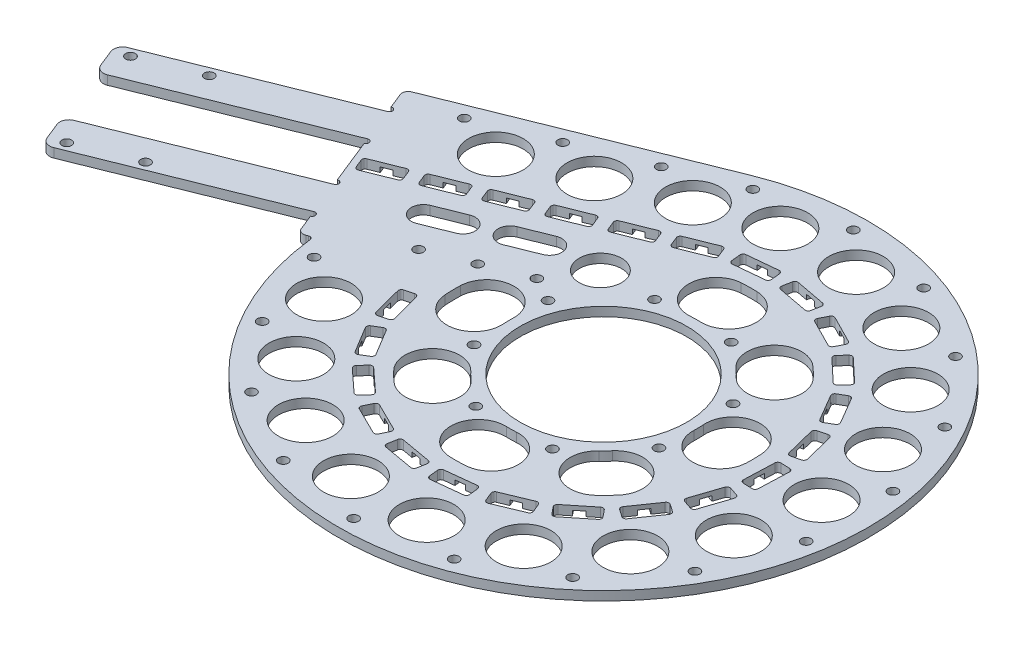
from build123d import *

# Parameters (mm, degrees)
SKETCH_1_R                       = 87.5
SKETCH_1_R_2                     = 27.5
EXTRUDE_1_DEPTH                  = 3
SKETCH_2_R                       = 1.6
CUT_EXTRUDE_1_DEPTH              = 3
PATTERN_CIRCULAR_1_COUNT         = 8
CUT_EXTRUDE_2_DEPTH              = 3
FILLET_1_R                       = 1
CUT_EXTRUDE_3_DEPTH              = 1.6
PATTERN_CIRCULAR_2_COUNT         = 18
PATTERN_CIRCULAR_2_ANGLE         = 277.1
FILLET_1_OF_PATTERN_CIRCULAR_2_R = 1
CUT_EXTRUDE_5_DEPTH              = 3
PATTERN_CIRCULAR_4_COUNT         = 7
PATTERN_CIRCULAR_4_ANGLE         = 270
EXTRUDE_2_DEPTH                  = 3
PATTERN_LINEAR_3_COUNT           = 6
PATTERN_LINEAR_3_PITCH           = 16
FILLET_1_OF_PATTERN_LINEAR_3_R   = 1
SKETCH_16_R                      = 1.6
CUT_EXTRUDE_6_DEPTH              = 10
PATTERN_LINEAR_4_COUNT           = 3
PATTERN_LINEAR_4_PITCH           = 15
SKETCH_18_R                      = 1.6
CUT_EXTRUDE_7_DEPTH              = 6.5
PATTERN_START                    = -1
PATTERN_CIRCULAR_5_OUTLINE_R     = 1.6
PATTERN_CIRCULAR_5_DEPTH         = 5
SKETCH_21_R                      = 9
CUT_EXTRUDE_8_DEPTH              = 6.5
PATTERN_CIRCULAR_6_OUTLINE_R     = 9
PATTERN_CIRCULAR_6_DEPTH         = 3
SKETCH_23_R                      = 1.6
SKETCH_23_R_2                    = 9
CUT_EXTRUDE_9_DEPTH              = 18
PATTERN_LINEAR_5_COUNT           = 3
PATTERN_LINEAR_5_PITCH           = 25
FILLET_2_R                       = 1
FILLET_3_R                       = 2
SKETCH_27_R                      = 1.6
EXTRUDE_3_DEPTH                  = 3
SKETCH_28_R                      = 1
CUT_EXTRUDE_10_DEPTH             = 3
FILLET_4_R                       = 3
SKETCH_30_R                      = 7
CUT_EXTRUDE_11_DEPTH             = 3


with BuildPart() as part:
    # 草图1 → 凸台-拉伸1 (new body)
    with BuildSketch(Plane(origin=(0, 0, 0), x_dir=(1, 0, 0), z_dir=(0, 1, 0))):
        with Locations(Location((0, 0, 0), (0, 0, 270))):
            Circle(SKETCH_1_R)
        with Locations(Location((0, 0, 0), (0, 0, 270))):
            Circle(SKETCH_1_R_2, mode=Mode.SUBTRACT)
    extrude(amount=EXTRUDE_1_DEPTH)

    # 草图2 → 切除-拉伸1 (cut)
    with BuildSketch(Plane(origin=(0, 3, 0), x_dir=(1, 0, 0), z_dir=(0, 1, 0))):
        with Locations(Location((-12.953736655, 29.806890255, 0), (0, 0, 270))):
            Circle(SKETCH_2_R)
    cut_extrude_1 = extrude(amount=-CUT_EXTRUDE_1_DEPTH, mode=Mode.SUBTRACT)

    # 阵列(圆周)1: 切除-拉伸1 ×8 about axis
    pattern_circular_1_axis = Axis((0, 0, 0), (0, 1, 0))
    for i in range(1, PATTERN_CIRCULAR_1_COUNT):
        add(cut_extrude_1.rotate(pattern_circular_1_axis, i * 360 / PATTERN_CIRCULAR_1_COUNT), mode=Mode.SUBTRACT)

    # 草图4 → 切除-拉伸2 (cut)
    with BuildSketch(Plane(origin=(0, 3, 0), x_dir=(1, 0, 0), z_dir=(0, 1, 0))):
        Polygon((-26.472850278, 49.711047043), (-27.406183612, 52.030290215), (-16.273816388, 56.510290215), (-14.407149722, 51.871803872), (-25.539516945, 47.391803872), align=None)
    cut_extrude_2 = extrude(amount=-CUT_EXTRUDE_2_DEPTH, mode=Mode.SUBTRACT)

    # 圆角1
    fillet_1_edges = [part.edges().sort_by_distance(p)[0] for p in [
        (-25.539516945, 1.5, -47.391803872),
        (-27.406183612, 1.5, -52.030290215),
        (-16.273816388, 1.5, -56.510290215),
        (-14.407149722, 1.5, -51.871803872),
    ]]
    fillet(fillet_1_edges, radius=FILLET_1_R)

    # 草图6 → 切除-拉伸3 (cut)
    with BuildSketch(Plane.XZ):
        with BuildLine():
            Line((-24.257648963, -55.992200053), (-20.52431563, -46.715227367))
            ThreePointArc((-20.52431563, -46.715227367), (-18.442666667, -45.82824507), (-17.55568437, -47.909894033))
            Line((-17.55568437, -47.909894033), (-21.289017704, -57.18686672))
            ThreePointArc((-21.289017704, -57.18686672), (-23.370666667, -58.073849016), (-24.257648963, -55.992200053))
        make_face()
    cut_extrude_3 = extrude(amount=-CUT_EXTRUDE_3_DEPTH, mode=Mode.SUBTRACT)

    # 阵列(圆周)2: 切除-拉伸2, 切除-拉伸3 ×18 about axis
    pattern_circular_2_axis = Axis((0, 0, 0), (0, -1, 0))
    add([cut_extrude_2.rotate(pattern_circular_2_axis, i * PATTERN_CIRCULAR_2_ANGLE / (PATTERN_CIRCULAR_2_COUNT - 1)) for i in range(1, PATTERN_CIRCULAR_2_COUNT)], mode=Mode.SUBTRACT)
    add([cut_extrude_3.rotate(pattern_circular_2_axis, i * PATTERN_CIRCULAR_2_ANGLE / (PATTERN_CIRCULAR_2_COUNT - 1)) for i in range(1, PATTERN_CIRCULAR_2_COUNT)], mode=Mode.SUBTRACT)

    # 圆角1 of 阵列(圆周)2
    fillet_1_of_pattern_circular_2_edges = [part.edges().sort_by_distance(p)[0] for p in [
        (-11.211661896, 1.5, -52.654996321),
        (-11.701429745, 1.5, -57.63095125),
        (0.240862085, 1.5, -58.806394086),
        (0.730629933, 1.5, -53.830439158),
        (4.017492106, 1.5, -53.685284363),
        (4.943995227, 1.5, -58.598693767),
        (16.736177795, 1.5, -56.375086278),
        (15.809674675, 1.5, -51.461676874),
        (18.923682264, 1.5, -50.399843746),
        (21.191975309, 1.5, -54.855721511),
        (31.886081946, 1.5, -49.411818203),
        (29.617788901, 1.5, -44.955940437),
        (32.308608654, 1.5, -43.06278912),
        (35.736344871, 1.5, -46.702929836),
        (44.472682589, 1.5, -38.476362917),
        (41.044946373, 1.5, -34.836222201),
        (43.096264862, 1.5, -32.263942024),
        (47.407890537, 1.5, -34.795716904),
        (53.484150248, 1.5, -24.447815285),
        (49.172524574, 1.5, -21.916040405),
        (50.419437504, 1.5, -18.871415469),
        (55.268343567, 1.5, -20.091296609),
        (58.196058302, 1.5, -8.453922058),
        (53.347152239, 1.5, -7.234040918),
        (53.689421007, 1.5, -3.961826844),
        (58.685806731, 1.5, -3.771748711),
        (58.229619211, 1.5, 8.219577027),
        (53.233233487, 1.5, 8.029498893),
        (52.643343307, 1.5, 11.266250727),
        (57.385552162, 1.5, 12.851007863),
        (53.582135036, 1.5, 24.232309114),
        (48.839926181, 1.5, 22.647551978),
        (47.36529798, 1.5, 25.588640981),
        (51.472106565, 1.5, 28.440679419),
        (44.627214314, 1.5, 38.297020022),
        (40.52040573, 1.5, 35.444981584),
        (38.279584007, 1.5, 37.853975329),
        (41.420848378, 1.5, 41.744021364),
        (32.084737894, 1.5, 49.283055854),
        (28.943473524, 1.5, 45.393009819),
        (26.11659663, 1.5, 47.076250705),
        (28.039792378, 1.5, 51.691585809),
        (16.962988131, 1.5, 56.307255604),
        (15.039792382, 1.5, 51.691920501),
        (11.8541113, 1.5, 52.514093778),
        (12.404633843, 1.5, 57.483693855),
        (0.477593657, 1.5, 58.804947958),
        (-0.072928886, 1.5, 53.83534788),
        (-3.361319115, 1.5, 53.730359517),
        (-4.227725964, 1.5, 58.65472132),
        (-16.046194293, 1.5, 56.575344884),
        (-15.179787444, 1.5, 51.65098308),
        (-18.30653505, 1.5, 50.62727303),
        (-20.520221349, 1.5, 55.11052999),
        (-31.280038053, 1.5, 49.797682872),
        (-29.066351753, 1.5, 45.314425912),
        (-31.780099321, 1.5, 43.454289629),
        (-35.163108122, 1.5, 47.136035336),
        (-43.99929782, 1.5, 39.016814214),
        (-40.616289019, 1.5, 35.335068506),
        (-42.698879967, 1.5, 32.788041259),
        (-46.979253167, 1.5, 35.372302326),
        (-53.181479728, 1.5, 25.099406644),
        (-48.901106528, 1.5, 22.515145577),
        (-50.185122586, 1.5, 19.485981399),
        (-55.018763484, 1.5, 20.765010588),
        (-58.088433537, 1.5, 9.164272432),
        (-53.254792639, 1.5, 7.885243243),
    ]]
    fillet(fillet_1_of_pattern_circular_2_edges, radius=FILLET_1_OF_PATTERN_CIRCULAR_2_R)

    # 草图10 → 切除-拉伸5 (cut)
    with BuildSketch(Plane(origin=(0, 3, 0), x_dir=(1, 0, 0), z_dir=(0, 1, 0))):
        with BuildLine():
            ThreePointArc((1.719289285, 48.969827898), (-0.845949711, 48.9926971), (-3.408870018, 48.881280724))
            ThreePointArc((-3.408870018, 48.881280724), (-11.760945454, 39.276967322), (-2.156632052, 30.924891887))
            ThreePointArc((-2.156632052, 30.924891887), (-0.535192674, 30.995379798), (1.08771363, 30.980911527))
            ThreePointArc((1.08771363, 30.980911527), (10.397959643, 39.659581885), (1.719289285, 48.969827898))
        make_face()
    cut_extrude_5 = extrude(amount=-CUT_EXTRUDE_5_DEPTH, mode=Mode.SUBTRACT)

    # 阵列(圆周)4: 切除-拉伸5 ×7 about axis
    pattern_circular_4_axis = Axis((0, 0, 0), (0, -1, 0))
    for i in range(1, PATTERN_CIRCULAR_4_COUNT):
        add(cut_extrude_5.rotate(pattern_circular_4_axis, i * PATTERN_CIRCULAR_4_ANGLE / (PATTERN_CIRCULAR_4_COUNT - 1)), mode=Mode.SUBTRACT)

    # 草图12 → 凸台-拉伸2 (add)
    with BuildSketch(Plane(origin=(0, 3, 0), x_dir=(1, 0, 0), z_dir=(0, 1, 0))):
        Polygon((-90.784026306, -10.124750252), (-114.304026306, 48.320177672), (-32.666666667, 81.173511005), (-87.073237232, -8.631416919), align=None)
    extrude(amount=-EXTRUDE_2_DEPTH)

    # 阵列(线性)3: 切除-拉伸2, 切除-拉伸3 ×6
    with Locations(*[Vector(-0.9276972686292778, 0, 0.37333333333333313) * (i * PATTERN_LINEAR_3_PITCH) for i in range(1, PATTERN_LINEAR_3_COUNT)]):
        add(cut_extrude_2, mode=Mode.SUBTRACT)
        add(cut_extrude_3, mode=Mode.SUBTRACT)

    # 圆角1 of 阵列(线性)3
    fillet_1_of_pattern_linear_3_edges = [part.edges().sort_by_distance(p)[0] for p in [
        (-40.382673243, 1.5, -41.418470538),
        (-42.24933991, 1.5, -46.056956881),
        (-31.116972686, 1.5, -50.536956881),
        (-29.25030602, 1.5, -45.898470538),
        (-55.225829541, 1.5, -35.445137205),
        (-57.092496208, 1.5, -40.083623548),
        (-45.960128984, 1.5, -44.563623548),
        (-44.093462318, 1.5, -39.925137205),
        (-70.068985839, 1.5, -29.471803872),
        (-71.935652506, 1.5, -34.110290215),
        (-60.803285282, 1.5, -38.590290215),
        (-58.936618616, 1.5, -33.951803872),
        (-84.912142137, 1.5, -23.498470538),
        (-86.778808804, 1.5, -28.136956881),
        (-75.64644158, 1.5, -32.616956881),
        (-73.779774914, 1.5, -27.978470538),
        (-99.755298435, 1.5, -17.525137205),
        (-101.621965102, 1.5, -22.163623548),
        (-90.489597879, 1.5, -26.643623548),
        (-88.622931212, 1.5, -22.005137205),
    ]]
    fillet(fillet_1_of_pattern_linear_3_edges, radius=FILLET_1_OF_PATTERN_LINEAR_3_R)

    # 草图16 → 切除-拉伸6 (cut)
    with BuildSketch(Plane(origin=(0, 3, 0), x_dir=(1, 0, 0), z_dir=(0, 1, 0))):
        with Locations(Location((-66.211320817, 5.153736091, 0), (0, 0, 270))):
            Circle(SKETCH_16_R)
    cut_extrude_6 = extrude(amount=-CUT_EXTRUDE_6_DEPTH, mode=Mode.SUBTRACT)

    # 阵列(线性)4: 切除-拉伸6 ×3
    with Locations(*[Vector(0.9276972686292778, 0, -0.37333333333333324) * (i * PATTERN_LINEAR_4_PITCH) for i in range(1, PATTERN_LINEAR_4_COUNT)]):
        add(cut_extrude_6, mode=Mode.SUBTRACT)

    # 草图18 → 切除-拉伸7 (cut)
    with BuildSketch(Plane(origin=(0, 3, 0), x_dir=(1, 0, 0), z_dir=(0, 1, 0))):
        with Locations(Location((0, 82.5, 0), (0, 0, 270))):
            Circle(SKETCH_18_R)
    extrude(amount=-CUT_EXTRUDE_7_DEPTH, mode=Mode.SUBTRACT)

    # 阵列(圆周)5: read off the stored shape, not the designer's step
    # 阵列(圆周)5 outline → 阵列(圆周)5 (cut)
    with BuildSketch(Plane(origin=(0, 0, 0), x_dir=(1, 0, 0), z_dir=(0, 1, 0)).offset(PATTERN_START)):
        with Locations((28.216661824, 77.524641215)):
            Circle(PATTERN_CIRCULAR_5_OUTLINE_R)
        with Locations((53.029977799, 63.198666557)):
            Circle(PATTERN_CIRCULAR_5_OUTLINE_R)
        with Locations((71.447095812, 41.25)):
            Circle(PATTERN_CIRCULAR_5_OUTLINE_R)
        with Locations((81.246639624, 14.325974658)):
            Circle(PATTERN_CIRCULAR_5_OUTLINE_R)
        with Locations((81.246639624, -14.325974658)):
            Circle(PATTERN_CIRCULAR_5_OUTLINE_R)
        with Locations((71.447095812, -41.25)):
            Circle(PATTERN_CIRCULAR_5_OUTLINE_R)
        with Locations((53.029977799, -63.198666557)):
            Circle(PATTERN_CIRCULAR_5_OUTLINE_R)
        with Locations((28.216661824, -77.524641215)):
            Circle(PATTERN_CIRCULAR_5_OUTLINE_R)
        with Locations((0, -82.5)):
            Circle(PATTERN_CIRCULAR_5_OUTLINE_R)
        with Locations((-28.216661824, -77.524641215)):
            Circle(PATTERN_CIRCULAR_5_OUTLINE_R)
        with Locations((-53.029977799, -63.198666557)):
            Circle(PATTERN_CIRCULAR_5_OUTLINE_R)
        with Locations((-71.447095812, -41.25)):
            Circle(PATTERN_CIRCULAR_5_OUTLINE_R)
        with Locations((-81.246639624, -14.325974658)):
            Circle(PATTERN_CIRCULAR_5_OUTLINE_R)
        with Locations((-28.216661824, 77.524641215)):
            Circle(PATTERN_CIRCULAR_5_OUTLINE_R)
    extrude(amount=PATTERN_CIRCULAR_5_DEPTH, mode=Mode.SUBTRACT)

    # 草图21 → 切除-拉伸8 (cut)
    with BuildSketch(Plane(origin=(0, 3, 0), x_dir=(1, 0, 0), z_dir=(0, 1, 0))):
        with Locations(Location((12.502668792, 70.906158217, 0), (0, 0, 270))):
            Circle(SKETCH_21_R)
    extrude(amount=-CUT_EXTRUDE_8_DEPTH, mode=Mode.SUBTRACT)

    # 阵列(圆周)6: read off the stored shape, not the designer's step
    # 阵列(圆周)6 outline → 阵列(圆周)6 (cut)
    with BuildSketch(Plane(origin=(0, 0, 0), x_dir=(1, 0, 0), z_dir=(0, 1, 0))):
        with Locations((36, 62.353829072)):
            Circle(PATTERN_CIRCULAR_6_OUTLINE_R)
        with Locations((-12.502668792, 70.906158217)):
            Circle(PATTERN_CIRCULAR_6_OUTLINE_R)
        with Locations((-67.657868697, -24.625450319)):
            Circle(PATTERN_CIRCULAR_6_OUTLINE_R)
        with Locations((-55.155199905, -46.280707897)):
            Circle(PATTERN_CIRCULAR_6_OUTLINE_R)
        with Locations((-36, -62.353829072)):
            Circle(PATTERN_CIRCULAR_6_OUTLINE_R)
        with Locations((-12.502668792, -70.906158217)):
            Circle(PATTERN_CIRCULAR_6_OUTLINE_R)
        with Locations((12.502668792, -70.906158217)):
            Circle(PATTERN_CIRCULAR_6_OUTLINE_R)
        with Locations((36, -62.353829072)):
            Circle(PATTERN_CIRCULAR_6_OUTLINE_R)
        with Locations((55.155199905, -46.280707897)):
            Circle(PATTERN_CIRCULAR_6_OUTLINE_R)
        with Locations((67.657868697, -24.625450319)):
            Circle(PATTERN_CIRCULAR_6_OUTLINE_R)
        with Locations((72, 0)):
            Circle(PATTERN_CIRCULAR_6_OUTLINE_R)
        with Locations((67.657868697, 24.625450319)):
            Circle(PATTERN_CIRCULAR_6_OUTLINE_R)
        with Locations((55.155199905, 46.280707897)):
            Circle(PATTERN_CIRCULAR_6_OUTLINE_R)
    extrude(amount=PATTERN_CIRCULAR_6_DEPTH, mode=Mode.SUBTRACT)

    # 草图23 → 切除-拉伸9 (cut)
    with BuildSketch(Plane(origin=(0, 3, 0), x_dir=(1, 0, 0), z_dir=(0, 1, 0))):
        with Locations(Location((-49.817794007, 68.881691329, 0), (0, 0, 270))):
            Circle(SKETCH_23_R)
        with Locations(Location((-34.301578149, 63.807536675, 0), (0, 0, 270))):
            Circle(SKETCH_23_R_2)
    cut_extrude_9 = extrude(amount=-CUT_EXTRUDE_9_DEPTH, mode=Mode.SUBTRACT)

    # 阵列(线性)5: 切除-拉伸9 ×3
    with Locations(*[Vector(-0.9276972686292778, 0, 0.37333333333333324) * (i * PATTERN_LINEAR_5_PITCH) for i in range(1, PATTERN_LINEAR_5_COUNT)]):
        add(cut_extrude_9, mode=Mode.SUBTRACT)

    # 圆角2
    fillet_2_edges = [part.edges().sort_by_distance(p)[0] for p in [
        (-87.073237232, 1.5, 8.631416919),
    ]]
    fillet(fillet_2_edges, radius=FILLET_2_R)

    # 圆角3
    fillet_3_edges = [part.edges().sort_by_distance(p)[0] for p in [
        (-90.784026306, 1.5, 10.124750252),
        (-114.304026306, 1.5, -48.320177672),
    ]]
    fillet(fillet_3_edges, radius=FILLET_3_R)

    # 草图27 → 凸台-拉伸3 (add)
    # profile 1 of 2: a face of its own
    with BuildSketch(Plane(origin=(0, 3, 0), x_dir=(1, 0, 0), z_dir=(0, 1, 0))):
        Polygon((-110.757359639, 39.50705362), (-174.768471175, 13.74705362), (-170.288471175, 2.614686396), (-106.277359639, 28.374686396), align=None)
        with Locations(Location((-169.009984832, 12.830628481, 0), (0, 0, 270))):
            Circle(SKETCH_27_R, mode=Mode.SUBTRACT)
        with Locations(Location((-150.456039459, 20.297295147, 0), (0, 0, 270))):
            Circle(SKETCH_27_R, mode=Mode.SUBTRACT)
    # profile 2 of 2: a face of its own
    with BuildSketch(Plane(origin=(0, 3, 0), x_dir=(1, 0, 0), z_dir=(0, 1, 0))):
        Polygon((-98.810692973, 9.820741024), (-94.330692973, -1.3116262), (-158.341804508, -27.0716262), (-162.821804508, -15.939258976), align=None)
        with Locations(Location((-136.269372792, -14.955201061, 0), (0, 0, 90))):
            Circle(SKETCH_27_R, mode=Mode.SUBTRACT)
        with Locations(Location((-154.823318165, -22.421867727, 0), (0, 0, 90))):
            Circle(SKETCH_27_R, mode=Mode.SUBTRACT)
    extrude(amount=-EXTRUDE_3_DEPTH)

    # 草图28 → 切除-拉伸10 (cut)
    with BuildSketch(Plane(origin=(0, 3, 0), x_dir=(1, 0, 0), z_dir=(0, 1, 0))):
        with Locations((-111.130692973, 40.434750888)):
            Circle(SKETCH_28_R)
        with Locations((-105.904026306, 27.446989128)):
            Circle(SKETCH_28_R)
        with Locations((-99.184026306, 10.748438292)):
            Circle(SKETCH_28_R)
        with Locations((-93.957359639, -2.239323469)):
            Circle(SKETCH_28_R)
    extrude(amount=-CUT_EXTRUDE_10_DEPTH, mode=Mode.SUBTRACT)

    # 圆角4
    fillet_4_edges = [part.edges().sort_by_distance(p)[0] for p in [
        (-170.288471175, 1.5, -2.614686396),
        (-174.768471175, 1.5, -13.74705362),
        (-162.821804508, 1.5, 15.939258976),
        (-158.341804508, 1.5, 27.0716262),
    ]]
    fillet(fillet_4_edges, radius=FILLET_4_R)

    # 草图30 → 切除-拉伸11 (cut)
    with BuildSketch(Plane(origin=(0, 3, 0), x_dir=(1, 0, 0), z_dir=(0, 1, 0))):
        with Locations(Location((-30.206781536, 29.181335632, 0), (0, 0, 270))):
            Circle(SKETCH_30_R)
        with BuildLine():
            Line((-56.509951949, 27.921771626), (-47.232979263, 31.655104959))
            ThreePointArc((-47.232979263, 31.655104959), (-42.028856855, 29.437649218), (-44.246312596, 24.23352681))
            Line((-44.246312596, 24.23352681), (-53.523285282, 20.500193477))
            ThreePointArc((-53.523285282, 20.500193477), (-58.72740769, 22.717649218), (-56.509951949, 27.921771626))
        make_face()
        with BuildLine():
            Line((-76.919291859, 19.708438292), (-67.642319173, 23.441771626))
            ThreePointArc((-67.642319173, 23.441771626), (-62.438196765, 21.224315884), (-64.655652506, 16.020193477))
            Line((-64.655652506, 16.020193477), (-73.932625192, 12.286860143))
            ThreePointArc((-73.932625192, 12.286860143), (-79.1367476, 14.504315884), (-76.919291859, 19.708438292))
        make_face()
    extrude(amount=-CUT_EXTRUDE_11_DEPTH, mode=Mode.SUBTRACT)


solid = part.part
